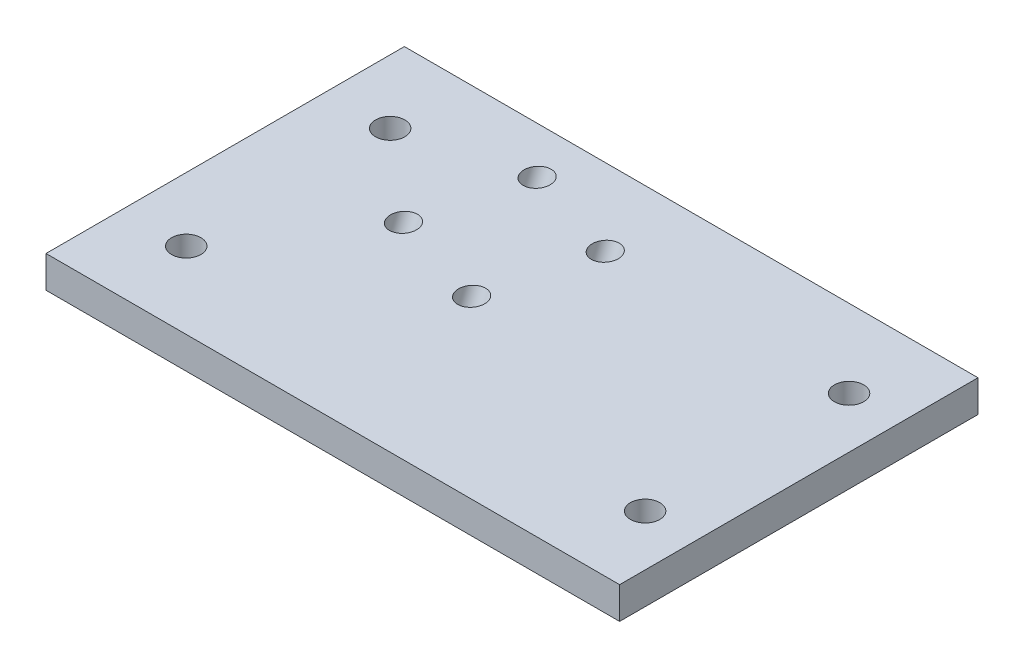
from build123d import *

# Parameters (mm, degrees)
SKETCH1_W           = 90
SKETCH1_H           = 56.23
BOSS_EXTRUDE1_DEPTH = 5
SKETCH2_R           = 2.3
CUT_EXTRUDE1_DEPTH  = 15
SKETCH6_R           = 2.03980448
CUT_EXTRUDE2_DEPTH  = 45
SKETCH7_R           = 2.3
CUT_EXTRUDE3_DEPTH  = 45


with BuildPart() as part:
    # Sketch1 → Boss-Extrude1 (new body)
    with BuildSketch(Plane(origin=(0, 0, 0), x_dir=(1, 0, 0), z_dir=(0, 1, 0))):
        with Locations((45, 28.115)):
            Rectangle(SKETCH1_W, SKETCH1_H)
    extrude(amount=BOSS_EXTRUDE1_DEPTH)

    # Sketch2 → Cut-Extrude1 (cut)
    with BuildSketch(Plane(origin=(0, 5, 0), x_dir=(1, 0, 0), z_dir=(0, 1, 0))):
        with Locations((82, 12)):
            Circle(SKETCH2_R)
        with Locations((10, 12)):
            Circle(SKETCH2_R)
    extrude(amount=-CUT_EXTRUDE1_DEPTH, mode=Mode.SUBTRACT)

    # Sketch6 → Cut-Extrude2 (cut)
    with BuildSketch(Plane(origin=(0, 23.828669586, -9.62740744), x_dir=(-1, 0, 0), z_dir=(0, 0.9271838545667871, -0.3746065934159128))):
        with Locations((-28.177489427, -43.444317788)):
            Circle(SKETCH6_R)
        with Locations((-23.817578468, -28.049800049)):
            Circle(SKETCH6_R)
        with Locations((-39.212096207, -23.689889089)):
            Circle(SKETCH6_R)
        with Locations((-43.572007167, -39.084406828)):
            Circle(SKETCH6_R)
    extrude(amount=-CUT_EXTRUDE2_DEPTH, mode=Mode.SUBTRACT)

    # Sketch7 → Cut-Extrude3 (cut)
    with BuildSketch(Plane(origin=(0, 5, 0), x_dir=(1, 0, 0), z_dir=(0, 1, 0))):
        with Locations((82, 44)):
            Circle(SKETCH7_R)
        with Locations((10, 44)):
            Circle(SKETCH7_R)
    extrude(amount=-CUT_EXTRUDE3_DEPTH, mode=Mode.SUBTRACT)


solid = part.part
